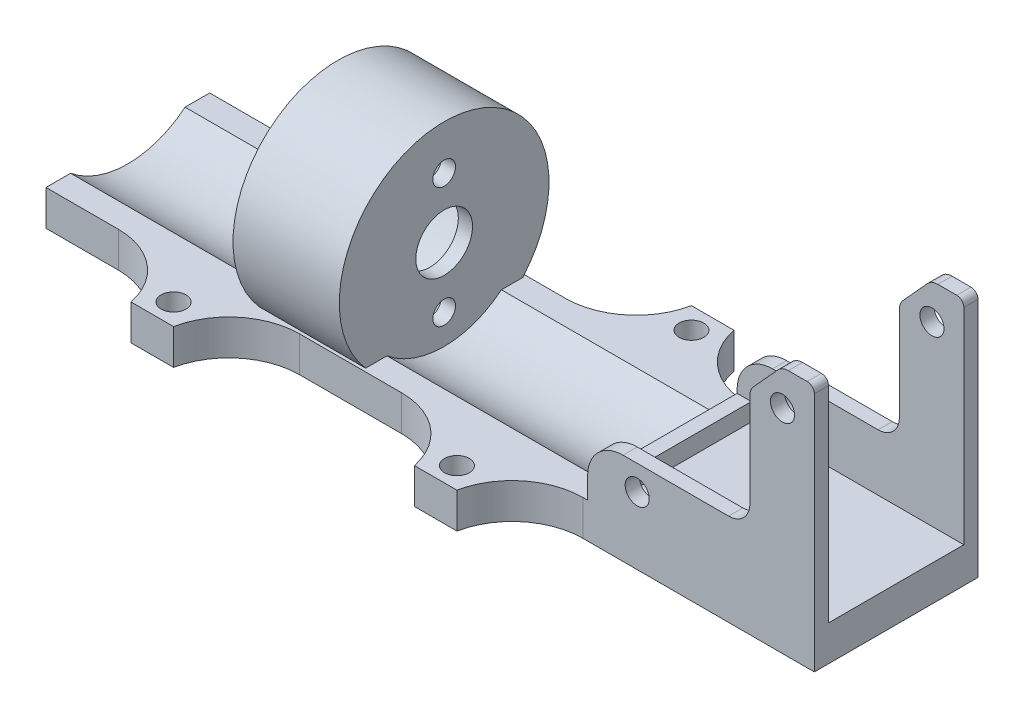
from build123d import *

# Parameters (mm, degrees)
SKETCH3_W                       = 111.348371095
SKETCH3_H                       = 23.1
BOSS_EXTRUDE1_DEPTH             = 5
SKETCH3_4_W                     = 34.9
SKETCH3_4_H                     = 23.1
BOSS_EXTRUDE2_DEPTH             = 2.5
CUT_EXTRUDE1_DEPTH              = 30.8
CUT_EXTRUDE1_DEPTH_BACK         = 67.894637304
SKETCH4_4_R                     = 12.7
BOSS_EXTRUDE3_START             = -1
SKETCH4_R                       = 12.7
SKETCH4_R_2                     = 4
SKETCH4_R_3                     = 1.6
BOSS_EXTRUDE3_DEPTH             = 2
BOSS_EXTRUDE4_DEPTH             = 2
BOSS_EXTRUDE4_DEPTH_BACK        = 13
BOSS_EXTRUDE4_START             = -3
SKETCH4_3_R                     = 14.8
SKETCH4_3_R_2                   = 12.7
BOSS_EXTRUDE6_REACH             = 105.413
SKETCH6_R                       = 1.7
BOSS_EXTRUDE6_DIRECTION_2_REACH = 105.413
CUT_EXTRUDE5_START              = -9.55
SKETCH6_9_R                     = 1.7
CUT_EXTRUDE5_DEPTH              = 19.1
FILLET1_R                       = 3
SKETCH12_W                      = 31.185762671
SKETCH12_H                      = 41.424107397
CUT_EXTRUDE9_DEPTH              = 2.9
FILLET2_R                       = 1
CUT_EXTRUDE10_DEPTH             = 108.072038083
FILLET3_R                       = 2
SKETCH14_W                      = 6
SKETCH14_H                      = 8
SKETCH14_R                      = 1.75
BOSS_EXTRUDE8_DEPTH             = 5
FILLET4_R                       = 10


with BuildPart() as part:
    # Sketch3 → Boss-Extrude1 (new body)
    with BuildSketch(Plane(origin=(0, 0, 0), x_dir=(1, 0, 0), z_dir=(0, 1, 0))):
        with Locations((-43.674185548, 0)):
            Rectangle(SKETCH3_W, SKETCH3_H)
    extrude(amount=-BOSS_EXTRUDE1_DEPTH)

    # Sketch3<4> → Boss-Extrude2 (add)
    with BuildSketch(Plane(origin=(0, 0, 0), x_dir=(1, 0, 0), z_dir=(0, 1, 0))):
        with Locations((-5.45, 0)):
            Rectangle(SKETCH3_4_W, SKETCH3_4_H)
        Polygon((-20.2, 9.55), (9.3, 9.55), (10, 9.55), (10, -9.55), (9.3, -9.55), (-20.2, -9.55), (-20.9, -9.55), (-20.9, 9.55), align=None, mode=Mode.SUBTRACT)
    extrude(amount=BOSS_EXTRUDE2_DEPTH)

    # Sketch4<4> → Cut-Extrude1 (cut, two sides: drawn at the far end of the back side and taken through both)
    with BuildSketch(Plane(origin=(-53.7, 0, 0), x_dir=(0, 0, -1), z_dir=(1, 0, 0)).offset(-CUT_EXTRUDE1_DEPTH_BACK)):
        with Locations((0, 9.8)):
            Circle(SKETCH4_4_R)
    extrude(amount=CUT_EXTRUDE1_DEPTH + CUT_EXTRUDE1_DEPTH_BACK, mode=Mode.SUBTRACT)

    # Sketch4 → Boss-Extrude3 (add)
    with BuildSketch(Plane(origin=(-53.7, 0, 0), x_dir=(0, 0, -1), z_dir=(1, 0, 0)).offset(BOSS_EXTRUDE3_START)):
        with Locations((0, 9.8)):
            Circle(SKETCH4_R)
        with Locations((0, 9.8)):
            Circle(SKETCH4_R_2, mode=Mode.SUBTRACT)
        with Locations((0, 18.3)):
            Circle(SKETCH4_R_3, mode=Mode.SUBTRACT)
        with Locations((0, 1.3)):
            Circle(SKETCH4_R_3, mode=Mode.SUBTRACT)
    extrude(amount=-BOSS_EXTRUDE3_DEPTH)

    # Sketch4<3> → Boss-Extrude4 (add, two sides: drawn at the far end of the back side and taken through both)
    with BuildSketch(Plane(origin=(-53.7, 0, 0), x_dir=(0, 0, -1), z_dir=(1, 0, 0)).offset(BOSS_EXTRUDE4_START - BOSS_EXTRUDE4_DEPTH_BACK)):
        with Locations((0, 9.8)):
            Circle(SKETCH4_3_R)
        with Locations((0, 9.8)):
            Circle(SKETCH4_3_R_2, mode=Mode.SUBTRACT)
    extrude(amount=BOSS_EXTRUDE4_DEPTH + BOSS_EXTRUDE4_DEPTH_BACK)

    # Boss-Extrude6: up to this face of the body (flat: up to its plane)
    boss_extrude6_end = Plane(part.part.faces().sort_by_distance((-38.495455163, -1.99193845, 11.55))[0])
    # Sketch6 → Boss-Extrude6 (add, up to the picked face)
    with BuildSketch(Plane.XY, mode=Mode.PRIVATE) as boss_extrude6_sk1:
        with BuildLine():
            Line((-22.9, 2.5), (-22.9, 3))
            ThreePointArc((-22.9, 3), (-21.435533906, 6.535533906), (-17.9, 8))
            Line((-17.9, 8), (-8.9, 8))
            Line((-8.9, 8), (0, 8))
            Line((0, 8), (0, 29))
            ThreePointArc((0, 29), (0.292893219, 29.707106781), (1, 30))
            Line((1, 30), (11, 30))
            ThreePointArc((11, 30), (11.707106781, 29.707106781), (12, 29))
            Line((12, 29), (12, 2.5))
            Line((12, 2.5), (12, 0))
            Line((12, 0), (10, 0))
            Line((10, 0), (10, 2.5))
            Line((10, 2.5), (-22.9, 2.5))
        make_face()
        with Locations(Location((-15.9, 4.5, 0), (0, 0, 180))):
            Circle(SKETCH6_R, mode=Mode.SUBTRACT)
        with Locations(Location((4.6, 25, 0), (0, 0, 180))):
            Circle(SKETCH6_R, mode=Mode.SUBTRACT)
    boss_extrude6_tool1 = split(extrude(boss_extrude6_sk1.sketch, amount=BOSS_EXTRUDE6_REACH, mode=Mode.PRIVATE), bisect_by=boss_extrude6_end, keep=Keep.BOTH, mode=Mode.PRIVATE)
    add(boss_extrude6_tool1.solids().sort_by(Axis((1.853009, 13.07203, 0), (0, 0, 1)))[0])

    # Boss-Extrude6 direction 2: up to this face of the body (flat: up to its plane)
    boss_extrude6_direction_2_end = Plane(part.part.faces().sort_by_distance((-38.495455163, -1.99193845, -11.55))[0])
    # Sketch6 → Boss-Extrude6 direction 2 (add, up to the picked face)
    with BuildSketch(Plane.XY, mode=Mode.PRIVATE) as boss_extrude6_direction_2_sk1:
        with BuildLine():
            Line((-22.9, 2.5), (-22.9, 3))
            ThreePointArc((-22.9, 3), (-21.435533906, 6.535533906), (-17.9, 8))
            Line((-17.9, 8), (-8.9, 8))
            Line((-8.9, 8), (0, 8))
            Line((0, 8), (0, 29))
            ThreePointArc((0, 29), (0.292893219, 29.707106781), (1, 30))
            Line((1, 30), (11, 30))
            ThreePointArc((11, 30), (11.707106781, 29.707106781), (12, 29))
            Line((12, 29), (12, 2.5))
            Line((12, 2.5), (12, 0))
            Line((12, 0), (10, 0))
            Line((10, 0), (10, 2.5))
            Line((10, 2.5), (-22.9, 2.5))
        make_face()
        with Locations(Location((-15.9, 4.5, 0), (0, 0, 180))):
            Circle(SKETCH6_R, mode=Mode.SUBTRACT)
        with Locations(Location((4.6, 25, 0), (0, 0, 180))):
            Circle(SKETCH6_R, mode=Mode.SUBTRACT)
    boss_extrude6_direction_2_tool1 = split(extrude(boss_extrude6_direction_2_sk1.sketch, amount=-BOSS_EXTRUDE6_DIRECTION_2_REACH, mode=Mode.PRIVATE), bisect_by=boss_extrude6_direction_2_end, keep=Keep.BOTH, mode=Mode.PRIVATE)
    add(boss_extrude6_direction_2_tool1.solids().sort_by(Axis((1.853009, 13.07203, 0), (0, 0, -1)))[0])

    # Sketch6<9> → Cut-Extrude5 (cut)
    with BuildSketch(Plane.XY.offset(CUT_EXTRUDE5_START)):
        with BuildLine():
            Line((-22.9, 2.5), (-22.9, 3))
            ThreePointArc((-22.9, 3), (-21.435533906, 6.535533906), (-17.9, 8))
            Line((-17.9, 8), (-8.9, 8))
            Line((-8.9, 8), (0, 8))
            Line((0, 8), (0, 29))
            ThreePointArc((0, 29), (0.292893219, 29.707106781), (1, 30))
            Line((1, 30), (11, 30))
            ThreePointArc((11, 30), (11.707106781, 29.707106781), (12, 29))
            Line((12, 29), (12, 2.5))
            Line((12, 2.5), (12, 0))
            Line((12, 0), (10, 0))
            Line((10, 0), (10, 2.5))
            Line((10, 2.5), (-22.9, 2.5))
        make_face()
        with Locations(Location((-15.9, 4.5, 0), (0, 0, 180))):
            Circle(SKETCH6_9_R, mode=Mode.SUBTRACT)
        with Locations(Location((4.6, 25, 0), (0, 0, 180))):
            Circle(SKETCH6_9_R, mode=Mode.SUBTRACT)
    extrude(amount=CUT_EXTRUDE5_DEPTH, mode=Mode.SUBTRACT)

    # Fillet1
    fillet1_edges = [part.edges().sort_by_distance(p)[0] for p in [
        (0, 8, -10.55),
        (0, 8, 10.55),
    ]]
    fillet(fillet1_edges, radius=FILLET1_R)

    # Sketch12 → Cut-Extrude9 (cut)
    with BuildSketch(Plane(origin=(12, 0, 0), x_dir=(0, 0, -1), z_dir=(1, 0, 0))):
        with Locations((1.113943618, 12.240146633)):
            Rectangle(SKETCH12_W, SKETCH12_H)
    extrude(amount=-CUT_EXTRUDE9_DEPTH, mode=Mode.SUBTRACT)

    # Fillet2
    fillet2_edges = [part.edges().sort_by_distance(p)[0] for p in [
        (9.1, 30, 10.55),
        (9.1, 30, -10.55),
    ]]
    fillet(fillet2_edges, radius=FILLET2_R)

    # Sketch13 → Cut-Extrude10 (cut, through all)
    with BuildSketch(Plane(origin=(0, 0, -11.55), x_dir=(-1, 0, 0), z_dir=(0, 0, -1))):
        Polygon((-4.55, 30), (0, 25), (0, 30), align=None)
    extrude(amount=-CUT_EXTRUDE10_DEPTH, mode=Mode.SUBTRACT)

    # Fillet3
    fillet3_edges = [part.edges().sort_by_distance(p)[0] for p in [
        (0, 25, 10.55),
        (4.55, 30, 10.55),
        (4.55, 30, -10.55),
        (0, 25, -10.55),
    ]]
    fillet(fillet3_edges, radius=FILLET3_R)

    # Sketch14 → Boss-Extrude8 (add)
    # profile 1 of 4: a face of its own
    with BuildSketch(Plane.XZ.offset(5)):
        with Locations((-76.348371095, -15.55)):
            Rectangle(SKETCH14_W, SKETCH14_H)
        with Locations(Location((-76.348371095, -16.55, 0), (0, 0, 270))):
            Circle(SKETCH14_R, mode=Mode.SUBTRACT)
    # profile 2 of 4: a face of its own
    with BuildSketch(Plane.XZ.offset(5)):
        with Locations((-76.348371095, 15.55)):
            Rectangle(SKETCH14_W, SKETCH14_H)
        with Locations(Location((-76.348371095, 16.55, 0), (0, 0, 270))):
            Circle(SKETCH14_R, mode=Mode.SUBTRACT)
    # profile 3 of 4: a face of its own
    with BuildSketch(Plane.XZ.offset(5)):
        with Locations((-36.348371095, -15.55)):
            Rectangle(SKETCH14_W, SKETCH14_H)
        with Locations(Location((-36.348371095, -16.55, 0), (0, 0, 270))):
            Circle(SKETCH14_R, mode=Mode.SUBTRACT)
    # profile 4 of 4: a face of its own
    with BuildSketch(Plane.XZ.offset(5)):
        with Locations((-36.348371095, 15.55)):
            Rectangle(SKETCH14_W, SKETCH14_H)
        with Locations(Location((-36.348371095, 16.55, 0), (0, 0, 270))):
            Circle(SKETCH14_R, mode=Mode.SUBTRACT)
    extrude(amount=-BOSS_EXTRUDE8_DEPTH)

    # Fillet4
    # the kernel refuses this fillet: 10 mm, written as the material it adds along each edge
    with BuildSketch(Plane(origin=(-79.348371095, -5, 11.55), x_dir=(-1, 0, 0), z_dir=(0, 1, 0)), Plane(origin=(-73.348371095, -5, -11.55), x_dir=(1, 0, 0), z_dir=(0, 1, 0)), Plane(origin=(-39.348371095, -5, 11.55), x_dir=(-1, 0, 0), z_dir=(0, 1, 0)), Plane(origin=(-33.348371095, -5, -11.55), x_dir=(1, 0, 0), z_dir=(0, 1, 0))) as fillet4_piece_1:
        with BuildLine():
            CenterArc((9.797958971, 10), FILLET4_R, 191.536959033, 78.463040967)
            Line((0, 8), (-0.195959179, 7.96))
            ThreePointArc((-0.195959179, 7.96), (-0.2, 4), (-0.2, 0))
            Line((-0.2, 0), (0, -0.2))
            Line((0, -0.2), (9.797958971, -0.2))
            Line((9.797958971, -0.2), (9.797958971, 0))
        make_face()
    extrude(amount=5)
    with BuildSketch(Plane(origin=(-73.348371095, -5, 11.55), x_dir=(1, 0, 0), z_dir=(0, 1, 0)), Plane(origin=(-79.348371095, -5, -11.55), x_dir=(-1, 0, 0), z_dir=(0, 1, 0)), Plane(origin=(-33.348371095, -5, 11.55), x_dir=(1, 0, 0), z_dir=(0, 1, 0)), Plane(origin=(-39.348371095, -5, -11.55), x_dir=(-1, 0, 0), z_dir=(0, 1, 0))) as fillet4_piece_2:
        with BuildLine():
            CenterArc((9.797958971, -10), FILLET4_R, 90, 78.463040967)
            Line((0, -8), (-0.195959179, -7.96))
            ThreePointArc((-0.195959179, -7.96), (-0.2, -4), (-0.2, 0))
            Line((-0.2, 0), (0, 0.2))
            Line((0, 0.2), (9.797958971, 0.2))
            Line((9.797958971, 0.2), (9.797958971, 0))
        make_face()
    extrude(amount=5)


solid = part.part
